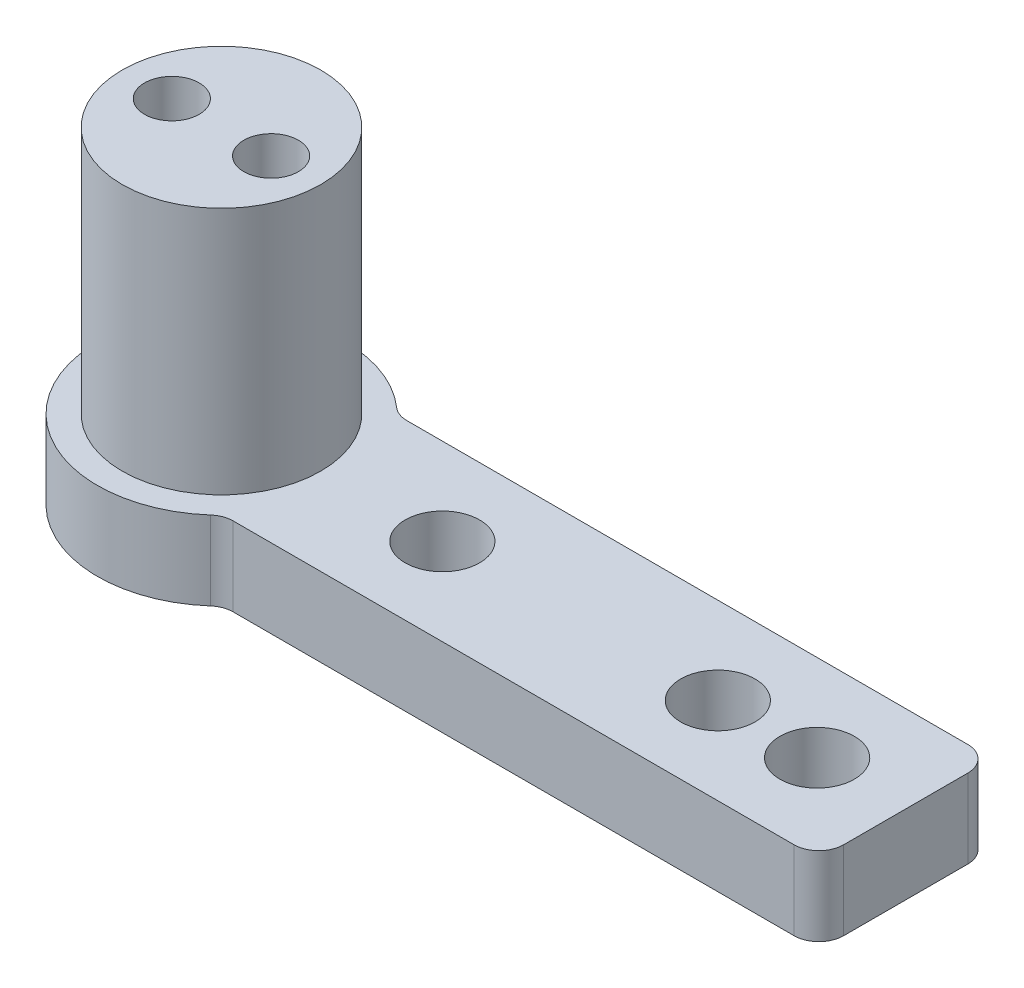
from build123d import *

# Parameters (mm, degrees)
SKETCH1_R           = 1.5
BOSS_EXTRUDE1_DEPTH = 3.175
SKETCH2_R           = 4
BOSS_EXTRUDE2_DEPTH = 10
FILLET1_R           = 1
SKETCH3_R           = 1.1
CUT_EXTRUDE1_DEPTH  = 5


with BuildPart() as part:
    # Sketch1 → Boss-Extrude1 (new body)
    with BuildSketch(Plane(origin=(0, 0, 0), x_dir=(1, 0, 0), z_dir=(0, 1, 0))):
        with BuildLine():
            Line((3.570714214, 3.5), (27.570714214, 3.5))
            Line((27.570714214, 3.5), (27.570714214, -3.5))
            Line((27.570714214, -3.5), (3.570714214, -3.5))
            ThreePointArc((3.570714214, -3.5), (-5, 0), (3.570714214, 3.5))
        make_face()
        with Locations((8.9, 0)):
            Circle(SKETCH1_R, mode=Mode.SUBTRACT)
        with Locations((20, 0)):
            Circle(SKETCH1_R, mode=Mode.SUBTRACT)
        with Locations((24, 0)):
            Circle(SKETCH1_R, mode=Mode.SUBTRACT)
    extrude(amount=BOSS_EXTRUDE1_DEPTH)

    # Sketch2 → Boss-Extrude2 (add)
    with BuildSketch(Plane(origin=(0, 3.175, 0), x_dir=(1, 0, 0), z_dir=(0, 1, 0))):
        Circle(SKETCH2_R)
    extrude(amount=BOSS_EXTRUDE2_DEPTH)

    # Fillet1
    fillet1_edges = [part.edges().sort_by_distance(p)[0] for p in [
        (3.570714214, 1.5875, -3.5),
        (3.570714214, 1.5875, 3.5),
        (27.570714214, 1.5875, -3.5),
        (27.570714214, 1.5875, 3.5),
    ]]
    fillet(fillet1_edges, radius=FILLET1_R)

    # Sketch3 → Cut-Extrude1 (cut)
    with BuildSketch(Plane(origin=(0, 13.175, 0), x_dir=(1, 0, 0), z_dir=(0, 1, 0))):
        with Locations((2, 0)):
            Circle(SKETCH3_R)
        with Locations((-2, 0)):
            Circle(SKETCH3_R)
    extrude(amount=-CUT_EXTRUDE1_DEPTH, mode=Mode.SUBTRACT)


solid = part.part
